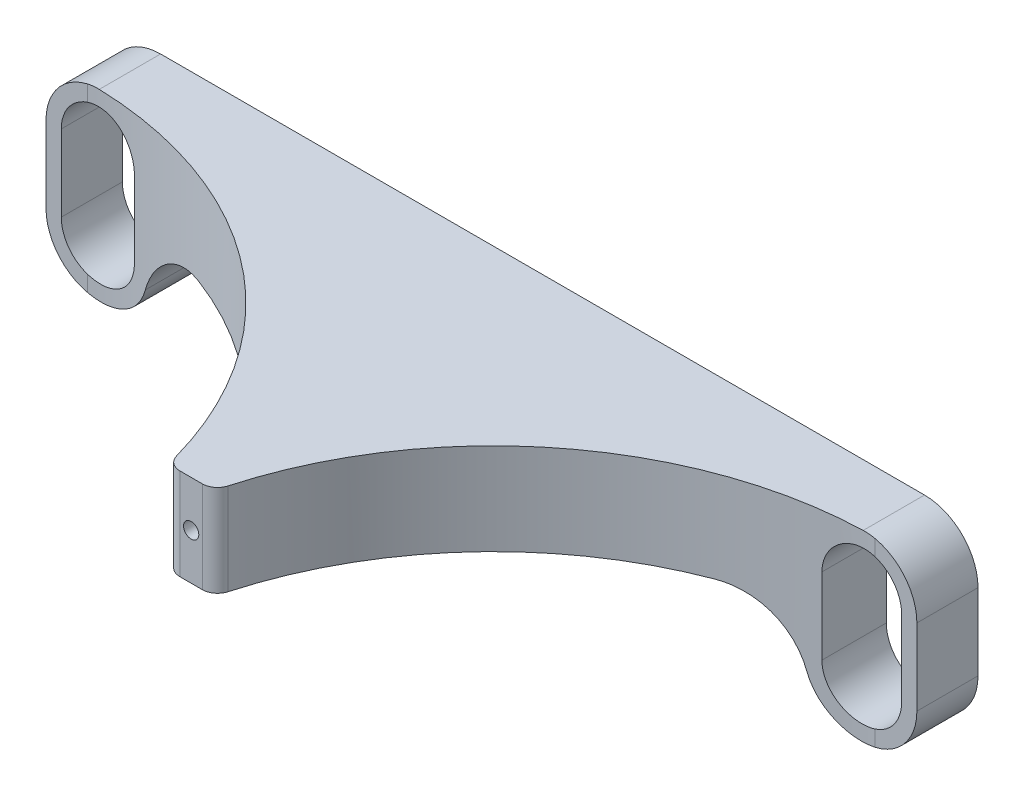
from build123d import *

# Parameters (mm, degrees)
SALIENTE_EXTRUIR1_DEPTH = 4
REDONDEO1_R             = 5
CROQUIS2_W              = 3
CROQUIS2_H              = 6
SALIENTE_EXTRUIR2_DEPTH = 19
REDONDEO2_START         = -11.5644
REDONDEO2_DEPTH         = 11.5644
REDONDEO2_START_2       = -6
REDONDEO2_2_DEPTH       = 6
REDONDEO2_START_3       = -11.999981249
REDONDEO2_3_DEPTH       = 5.957327692
REDONDEO2_START_4       = 4
REDONDEO2_4_DEPTH       = 20
CROQUIS3_R              = 0.5
CORTAR_EXTRUIR1_DEPTH   = 2
REDONDEO3_R             = 1


with BuildPart() as part:
    # Croquis1 → Saliente-Extruir1 (new body)
    # profile 1 of 4: a face of its own
    with BuildSketch(Plane.XY):
        with BuildLine():
            Line((-21.5, -3.5), (-21.5, -8.5))
            ThreePointArc((-21.5, -8.5), (-25, -12), (-28.5, -8.5))
            Line((-28.5, -8.5), (-28.5, -3.5))
            ThreePointArc((-28.5, -3.5), (-25, 0), (-21.5, -3.5))
        make_face()
        with BuildLine():
            ThreePointArc((-27.5, -8.5), (-25, -11), (-22.5, -8.5))
            Line((-22.5, -8.5), (-22.5, -3.5))
            ThreePointArc((-22.5, -3.5), (-25, -1), (-27.5, -3.5))
            Line((-27.5, -3.5), (-27.5, -8.5))
        make_face(mode=Mode.SUBTRACT)
    # profile 2 of 4: a face of its own
    with BuildSketch(Plane.XY):
        with BuildLine():
            Line((0, 0), (-25, 0))
            ThreePointArc((-25, 0), (-22.525126266, -1.025126266), (-21.5, -3.5))
            Line((-21.5, -3.5), (-21.5, -6))
            Line((-21.5, -6), (0, -6))
            Line((0, -6), (0, 0))
        make_face()
    # profile 3 of 4: a face of its own
    with BuildSketch(Plane.XY):
        with BuildLine():
            Line((25, 0), (0, 0))
            Line((0, 0), (0, -6))
            Line((0, -6), (21.5, -6))
            Line((21.5, -6), (21.5, -3.5))
            ThreePointArc((21.5, -3.5), (22.525126266, -1.025126266), (25, 0))
        make_face()
    # profile 4 of 4: a face of its own
    with BuildSketch(Plane.XY):
        with BuildLine():
            ThreePointArc((28.5, -8.5), (25, -12), (21.5, -8.5))
            Line((21.5, -8.5), (21.5, -3.5))
            ThreePointArc((21.5, -3.5), (25, 0), (28.5, -3.5))
            Line((28.5, -3.5), (28.5, -8.5))
        make_face()
        with BuildLine():
            Line((22.5, -3.5), (22.5, -8.5))
            ThreePointArc((22.5, -8.5), (25, -11), (27.5, -8.5))
            Line((27.5, -8.5), (27.5, -3.5))
            ThreePointArc((27.5, -3.5), (25, -1), (22.5, -3.5))
        make_face(mode=Mode.SUBTRACT)
    extrude(amount=SALIENTE_EXTRUIR1_DEPTH)

    # Redondeo1
    redondeo1_edges = [part.edges().sort_by_distance(p)[0] for p in [
        (21.5, -6, 2),
        (-21.5, -6, 2),
    ]]
    fillet(redondeo1_edges, radius=REDONDEO1_R)

    # Croquis2 → Saliente-Extruir2 (add)
    with BuildSketch(Plane.XY.offset(4)):
        with Locations((0, -3)):
            Rectangle(CROQUIS2_W, CROQUIS2_H)
    extrude(amount=SALIENTE_EXTRUIR2_DEPTH)

    # Redondeo2: read off the stored shape, not the designer's step
    # Redondeo2 outline → Redondeo2 (add)
    with BuildSketch(Plane(origin=(0, 0, 0), x_dir=(1, 0, 0), z_dir=(0, 1, 0)).offset(REDONDEO2_START)):
        with BuildLine():
            ThreePointArc((1.5, -23), (9.10150319, -10.367130938), (22.5, -4.214691199))
            Line((22.5, -4.214691199), (22.5, -4))
            Line((22.5, -4), (1.5, -4))
            Line((1.5, -4), (1.5, -23))
        make_face()
        with BuildLine():
            Line((-22.5, -4), (-22.5, -4.214691199))
            ThreePointArc((-22.5, -4.214691199), (-9.10150319, -10.367130938), (-1.5, -23))
            Line((-1.5, -23), (-1.5, -4))
            Line((-1.5, -4), (-22.5, -4))
        make_face()
    extrude(amount=REDONDEO2_DEPTH)

    # Redondeo2 2 outline → Redondeo2 2 (add)
    with BuildSketch(Plane(origin=(0, 0, 0), x_dir=(1, 0, 0), z_dir=(0, 1, 0)).offset(REDONDEO2_START_2)):
        with BuildLine():
            ThreePointArc((22.5, -4.214691199), (24.131140284, -4.053730539), (25.769322199, -4))
            Line((25.769322199, -4), (22.5, -4))
            Line((22.5, -4), (22.5, -4.214691199))
        make_face()
        with BuildLine():
            Line((-22.5, -4), (-25.769322199, -4))
            ThreePointArc((-25.769322199, -4), (-24.131140284, -4.053730539), (-22.5, -4.214691199))
            Line((-22.5, -4.214691199), (-22.5, -4))
        make_face()
    extrude(amount=REDONDEO2_2_DEPTH)

    # Redondeo2 3 outline → Redondeo2 3 (add)
    with BuildSketch(Plane(origin=(0, 0, 0), x_dir=(1, 0, 0), z_dir=(0, 1, 0)).offset(REDONDEO2_START_3)):
        with BuildLine():
            ThreePointArc((22.5, -4.214691199), (24.131140284, -4.053730539), (25.769322199, -4))
            Line((25.769322199, -4), (22.5, -4))
            Line((22.5, -4), (22.5, -4.214691199))
        make_face()
        with BuildLine():
            Line((-22.5, -4), (-25.769322199, -4))
            ThreePointArc((-25.769322199, -4), (-24.131140284, -4.053730539), (-22.5, -4.214691199))
            Line((-22.5, -4.214691199), (-22.5, -4))
        make_face()
    extrude(amount=REDONDEO2_3_DEPTH)

    # Redondeo2 4 outline → Redondeo2 4 (cut)
    with BuildSketch(Plane.XY.offset(REDONDEO2_START_4)):
        with BuildLine():
            Line((-24.988543271, -11.999981249), (-22.5, -11.999981249))
            Line((-22.5, -11.999981249), (-22.5, -11.5644))
            Line((-22.5, -11.5644), (-1.5, -11.5644))
            Line((-1.5, -11.5644), (-1.5, -6))
            Line((-1.5, -6), (-16.875961595, -6))
            ThreePointArc((-16.875961595, -6), (-19.846404224, -6.978001667), (-21.654807716, -9.529411765))
            ThreePointArc((-21.654807716, -9.529411765), (-22.916085044, -11.311991902), (-24.988543271, -11.999981249))
        make_face()
        with BuildLine():
            Line((-25.769322199, -11.999981249), (-25.011456729, -11.999981249))
            ThreePointArc((-25.011456729, -11.999981249), (-25.392727477, -11.977896653), (-25.769322199, -11.914402342))
            Line((-25.769322199, -11.914402342), (-25.769322199, -11.999981249))
        make_face()
        with BuildLine():
            Line((22.5, -6), (25.769322199, -6))
            Line((25.769322199, -6), (25.769322199, -1.121314785))
            ThreePointArc((25.769322199, -1.121314785), (23.529167837, -1.478452882), (22.5, -3.5))
            Line((22.5, -3.5), (22.5, -6))
        make_face()
        with BuildLine():
            ThreePointArc((22.5, -8.5), (23.529167837, -10.521547118), (25.769322199, -10.878685215))
            Line((25.769322199, -10.878685215), (25.769322199, -6.042653557))
            Line((25.769322199, -6.042653557), (22.5, -6.042653557))
            Line((22.5, -6.042653557), (22.5, -8.5))
        make_face()
        with BuildLine():
            Line((25.011456729, -11.999981249), (25.769322199, -11.999981249))
            Line((25.769322199, -11.999981249), (25.769322199, -11.914402342))
            ThreePointArc((25.769322199, -11.914402342), (25.392727477, -11.977896653), (25.011456729, -11.999981249))
        make_face()
        with BuildLine():
            Line((1.5, -11.5644), (22.5, -11.5644))
            Line((22.5, -11.5644), (22.5, -11.999981249))
            Line((22.5, -11.999981249), (24.988543271, -11.999981249))
            ThreePointArc((24.988543271, -11.999981249), (22.916085044, -11.311991902), (21.654807716, -9.529411765))
            ThreePointArc((21.654807716, -9.529411765), (19.846404224, -6.978001667), (16.875961595, -6))
            Line((16.875961595, -6), (1.5, -6))
            Line((1.5, -6), (1.5, -11.5644))
        make_face()
        with BuildLine():
            ThreePointArc((25, 0), (25.387034755, -0.021465237), (25.769322199, -0.085597658))
            Line((25.769322199, -0.085597658), (25.769322199, 0))
            Line((25.769322199, 0), (25, 0))
        make_face()
        with BuildLine():
            ThreePointArc((-25.769322199, -10.878685215), (-23.529167837, -10.521547118), (-22.5, -8.5))
            Line((-22.5, -8.5), (-22.5, -6.042653557))
            Line((-22.5, -6.042653557), (-25.769322199, -6.042653557))
            Line((-25.769322199, -6.042653557), (-25.769322199, -10.878685215))
        make_face()
        with BuildLine():
            ThreePointArc((-25.769322199, -0.085597658), (-25.387034755, -0.021465237), (-25, 0))
            Line((-25, 0), (-25.769322199, 0))
            Line((-25.769322199, 0), (-25.769322199, -0.085597658))
        make_face()
        with BuildLine():
            Line((-25.769322199, -6), (-22.5, -6))
            Line((-22.5, -6), (-22.5, -3.5))
            ThreePointArc((-22.5, -3.5), (-23.529167837, -1.478452882), (-25.769322199, -1.121314785))
            Line((-25.769322199, -1.121314785), (-25.769322199, -6))
        make_face()
    extrude(amount=REDONDEO2_4_DEPTH, mode=Mode.SUBTRACT)

    # Croquis3 → Cortar-Extruir1 (cut)
    with BuildSketch(Plane.XY.offset(23)):
        with Locations((0, -3)):
            Circle(CROQUIS3_R)
    extrude(amount=-CORTAR_EXTRUIR1_DEPTH, mode=Mode.SUBTRACT)

    # Redondeo3
    redondeo3_edges = [part.edges().sort_by_distance(p)[0] for p in [
        (-1.5, -3, 23),
        (1.5, -3, 23),
    ]]
    fillet(redondeo3_edges, radius=REDONDEO3_R)


solid = part.part
